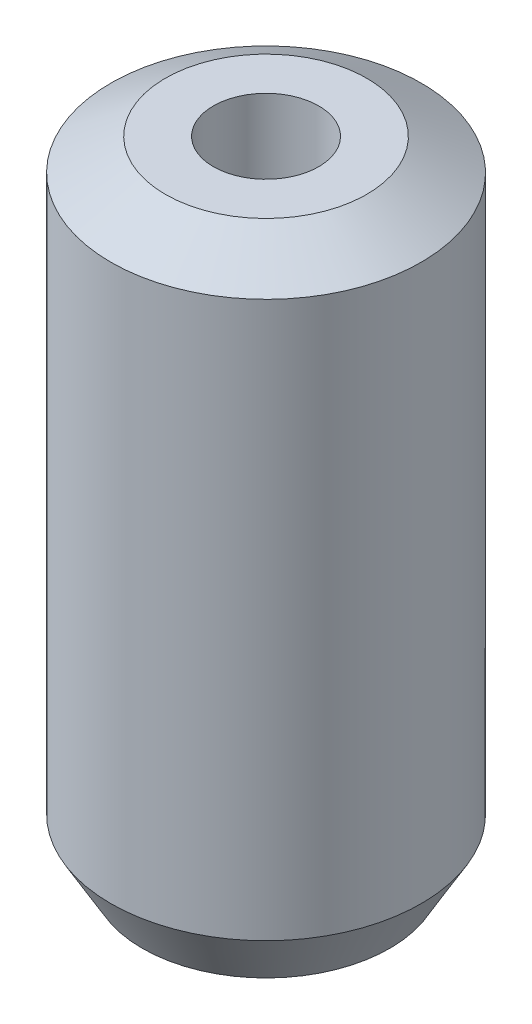
from build123d import *
from OCP.BRepFilletAPI import BRepFilletAPI_MakeChamfer

# Parameters (mm, degrees)
SKETCH1_R           = 27.5
BOSS_EXTRUDE1_DEPTH = 113.667346683
SKETCH2_R           = 9.335915837
CUT_EXTRUDE1_DEPTH  = 121.136446185
CHAMFER1_SIZE       = 5.577951577
CHAMFER1_SIZE2      = 9.661295534


with BuildPart() as part:
    # Sketch1 → Boss-Extrude1 (new body)
    with BuildSketch(Plane(origin=(0, 0, 0), x_dir=(1, 0, 0), z_dir=(0, 1, 0))):
        Circle(SKETCH1_R)
    extrude(amount=BOSS_EXTRUDE1_DEPTH)

    # Sketch2 → Cut-Extrude1 (cut, through all)
    with BuildSketch(Plane(origin=(0, 0, 0), x_dir=(1, 0, 0), z_dir=(0, 1, 0))):
        Circle(SKETCH2_R)
    extrude(amount=CUT_EXTRUDE1_DEPTH, mode=Mode.SUBTRACT)

    # Chamfer1: one chamfer whose edges measure the first distance from different faces: ONE call of the kernel's chamfer builder (chamfer() names one face for all edges)
    chamfer1_edges_1 = [part.edges().sort_by_distance(p)[0] for p in [
        (-27.5, 113.667346683, 0),
    ]]
    chamfer1_side_1 = [part.faces().sort_by_distance(p)[0] for p in [
        (-27.5, 56.833673341, 0),
    ]]
    chamfer1_edges_2 = [part.edges().sort_by_distance(p)[0] for p in [
        (-27.5, 0, 0),
    ]]
    chamfer1_side_2 = [part.faces().sort_by_distance(p)[0] for p in [
        (-26.722182541, 0, 0),
    ]]
    chamfer1 = BRepFilletAPI_MakeChamfer(part.part.solid().wrapped)
    for e in chamfer1_edges_1:
        chamfer1.Add(CHAMFER1_SIZE, CHAMFER1_SIZE2, e.wrapped, chamfer1_side_1[0].wrapped)  # the first distance lies on this face
    for e in chamfer1_edges_2:
        chamfer1.Add(CHAMFER1_SIZE, CHAMFER1_SIZE2, e.wrapped, chamfer1_side_2[0].wrapped)  # the first distance lies on this face
    add(Compound.cast(chamfer1.Shape()), mode=Mode.REPLACE)


solid = part.part
